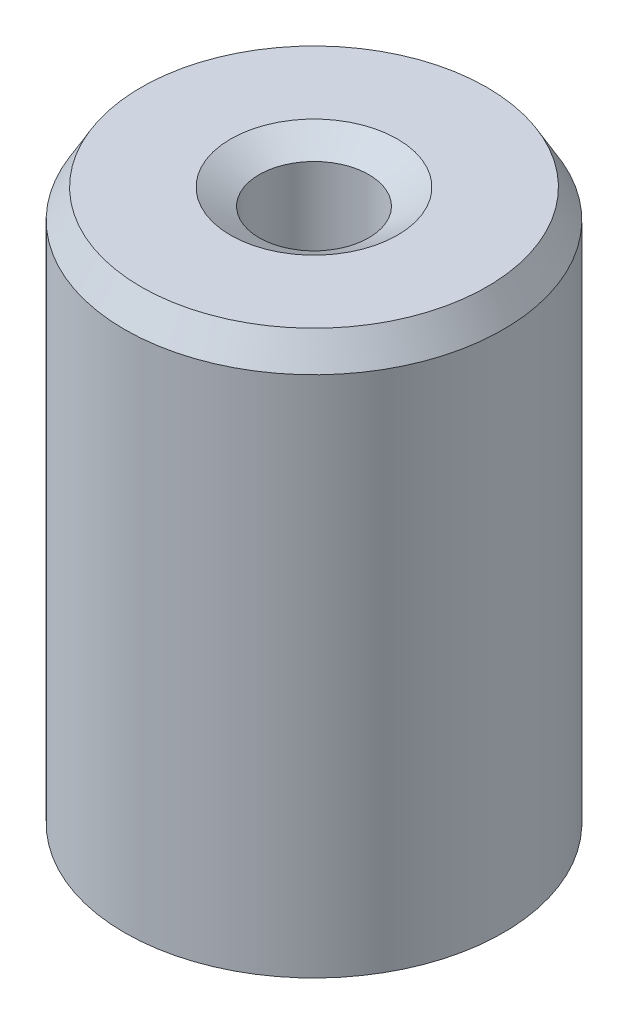
from build123d import *
from OCP.BRepFilletAPI import BRepFilletAPI_MakeChamfer

# Parameters (mm, degrees)
SKETCH1_R           = 5
BOSS_EXTRUDE1_DEPTH = 14.983907351
SKETCH2_R           = 1.446360327
CUT_EXTRUDE1_DEPTH  = 17.568569024
CHAMFER1_SIZE       = 0.755566857
CHAMFER1_SIZE2      = 0.436226728


with BuildPart() as part:
    # Sketch1 → Boss-Extrude1 (new body)
    with BuildSketch(Plane(origin=(0, 0, 0), x_dir=(1, 0, 0), z_dir=(0, 1, 0))):
        Circle(SKETCH1_R)
    extrude(amount=BOSS_EXTRUDE1_DEPTH)

    # Sketch2 → Cut-Extrude1 (cut, through all)
    with BuildSketch(Plane(origin=(0, 0, 0), x_dir=(1, 0, 0), z_dir=(0, 1, 0))):
        Circle(SKETCH2_R)
    extrude(amount=CUT_EXTRUDE1_DEPTH, mode=Mode.SUBTRACT)

    # Chamfer1: one chamfer whose edges measure the first distance from different faces: ONE call of the kernel's chamfer builder (chamfer() names one face for all edges)
    chamfer1_edges_1 = [part.edges().sort_by_distance(p)[0] for p in [
        (-1.446360327, 14.983907351, 0),
    ]]
    chamfer1_side_1 = [part.faces().sort_by_distance(p)[0] for p in [
        (-4.858578644, 14.983907351, 0),
    ]]
    chamfer1_edges_2 = [part.edges().sort_by_distance(p)[0] for p in [
        (-1.446360327, 0, 0),
    ]]
    chamfer1_side_2 = [part.faces().sort_by_distance(p)[0] for p in [
        (-1.446360327, 7.491953676, 0),
    ]]
    chamfer1_edges_3 = [part.edges().sort_by_distance(p)[0] for p in [
        (-5, 0, 0),
    ]]
    chamfer1_side_3 = [part.faces().sort_by_distance(p)[0] for p in [
        (-4.858578644, 0, 0),
    ]]
    chamfer1_edges_4 = [part.edges().sort_by_distance(p)[0] for p in [
        (-5, 14.983907351, 0),
    ]]
    chamfer1_side_4 = [part.faces().sort_by_distance(p)[0] for p in [
        (-5, 7.491953676, 0),
    ]]
    chamfer1 = BRepFilletAPI_MakeChamfer(part.part.solid().wrapped)
    for e in chamfer1_edges_1:
        chamfer1.Add(CHAMFER1_SIZE, CHAMFER1_SIZE2, e.wrapped, chamfer1_side_1[0].wrapped)  # the first distance lies on this face
    for e in chamfer1_edges_2:
        chamfer1.Add(CHAMFER1_SIZE, CHAMFER1_SIZE2, e.wrapped, chamfer1_side_2[0].wrapped)  # the first distance lies on this face
    for e in chamfer1_edges_3:
        chamfer1.Add(CHAMFER1_SIZE, CHAMFER1_SIZE2, e.wrapped, chamfer1_side_3[0].wrapped)  # the first distance lies on this face
    for e in chamfer1_edges_4:
        chamfer1.Add(CHAMFER1_SIZE, CHAMFER1_SIZE2, e.wrapped, chamfer1_side_4[0].wrapped)  # the first distance lies on this face
    add(Compound.cast(chamfer1.Shape()), mode=Mode.REPLACE)


solid = part.part
